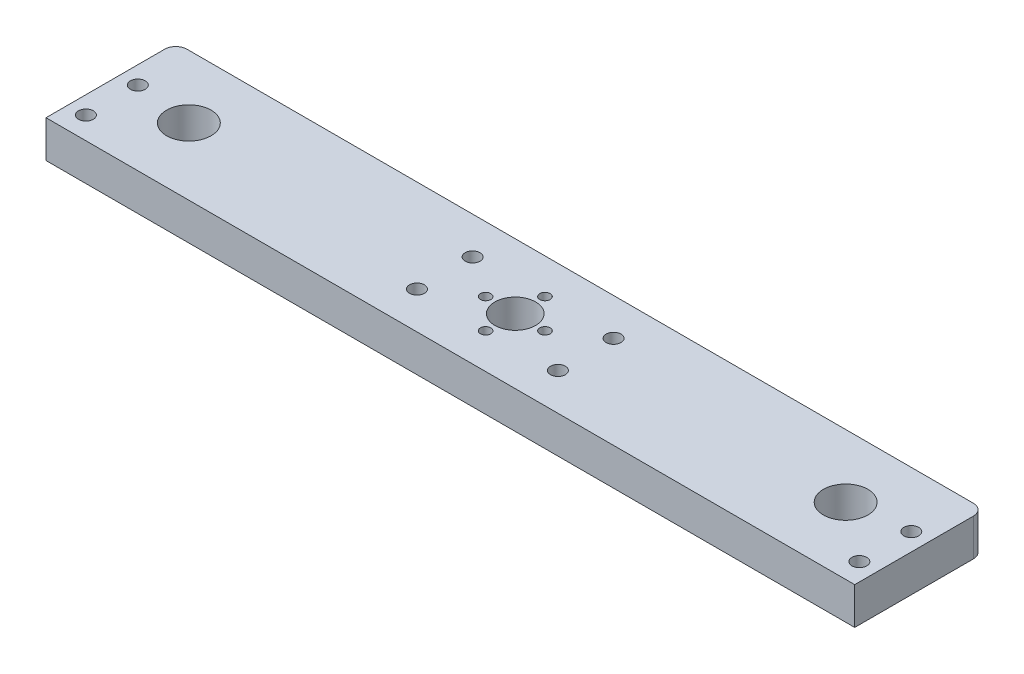
from build123d import *

# Parameters (mm, degrees)
SKETCH_1_W          = 218
SKETCH_1_H          = 35
EXTRUDE_1_DEPTH     = 10
FILLET_1_R          = 3
SKETCH_2_R          = 2
CUT_EXTRUDE_1_DEPTH = 222.018098806
SKETCH_6_R          = 5.5
CUT_EXTRUDE_2_DEPTH = 222.018098806
SKETCH_8_R          = 1.4
CUT_EXTRUDE_5_DEPTH = 222.018098806
SKETCH_10_R         = 6
CUT_EXTRUDE_6_DEPTH = 222.018098806
SKETCH_11_R         = 2
CUT_EXTRUDE_7_DEPTH = 222.018098806
SKETCH_12_R         = 4
CUT_EXTRUDE_8_DEPTH = 5


with BuildPart() as part:
    # 草图1 → 凸台-拉伸1 (new body)
    with BuildSketch(Plane(origin=(0, 0, 0), x_dir=(1, 0, 0), z_dir=(0, 1, 0))):
        with Locations((109, -17.5)):
            Rectangle(SKETCH_1_W, SKETCH_1_H)
    extrude(amount=EXTRUDE_1_DEPTH)

    # 圆角1
    fillet_1_edges = [part.edges().sort_by_distance(p)[0] for p in [
        (0, 5, 0),
        (218, 5, 0),
    ]]
    fillet(fillet_1_edges, radius=FILLET_1_R)

    # 草图2 → 切除-拉伸1 (cut, through all)
    with BuildSketch(Plane(origin=(0, 10, 0), x_dir=(1, 0, 0), z_dir=(0, 1, 0))):
        with Locations((4.75, -15)):
            Circle(SKETCH_2_R)
        with Locations((4.75, -29)):
            Circle(SKETCH_2_R)
    cut_extrude_1 = extrude(amount=-CUT_EXTRUDE_1_DEPTH, mode=Mode.SUBTRACT)

    # 镜向5: 切除-拉伸1 across plane
    add(cut_extrude_1.mirror(Plane(origin=(109, 0, 0), x_dir=(0, 0, 1), z_dir=(1, 0, 0))), mode=Mode.SUBTRACT)

    # 草图6 → 切除-拉伸2 (cut, through all)
    with BuildSketch(Plane.XZ):
        with Locations((109, 17.5)):
            Circle(SKETCH_6_R)
    extrude(amount=-CUT_EXTRUDE_2_DEPTH, mode=Mode.SUBTRACT)

    # 草图8 → 切除-拉伸5 (cut, through all)
    with BuildSketch(Plane.XZ):
        with Locations((109, 9.5)):
            Circle(SKETCH_8_R)
        with Locations((117, 17.5)):
            Circle(SKETCH_8_R)
        with Locations((101, 17.5)):
            Circle(SKETCH_8_R)
        with Locations((109, 25.5)):
            Circle(SKETCH_8_R)
    extrude(amount=-CUT_EXTRUDE_5_DEPTH, mode=Mode.SUBTRACT)

    # 草图10 → 切除-拉伸6 (cut, through all)
    with BuildSketch(Plane.XZ):
        with Locations((197.526194604, 16.97)):
            Circle(SKETCH_10_R)
        with Locations((20.473805396, 16.97)):
            Circle(SKETCH_10_R)
    extrude(amount=-CUT_EXTRUDE_6_DEPTH, mode=Mode.SUBTRACT)

    # 草图11 → 切除-拉伸7 (cut, through all)
    with BuildSketch(Plane.XZ):
        with Locations((128, 10)):
            Circle(SKETCH_11_R)
        with Locations((128, 25)):
            Circle(SKETCH_11_R)
    cut_extrude_7 = extrude(amount=-CUT_EXTRUDE_7_DEPTH, mode=Mode.SUBTRACT)

    # 镜向6: 切除-拉伸7 across plane
    add(cut_extrude_7.mirror(Plane(origin=(109, 0, 0), x_dir=(0, 0, 1), z_dir=(1, 0, 0))), mode=Mode.SUBTRACT)

    # 草图12 → 切除-拉伸8 (cut)
    with BuildSketch(Plane.XZ):
        with Locations((213.25, 15)):
            Circle(SKETCH_12_R)
        with Locations((213.25, 29)):
            Circle(SKETCH_12_R)
        with Locations((4.75, 15)):
            Circle(SKETCH_12_R)
        with Locations((4.75, 29)):
            Circle(SKETCH_12_R)
    extrude(amount=-CUT_EXTRUDE_8_DEPTH, mode=Mode.SUBTRACT)


solid = part.part
